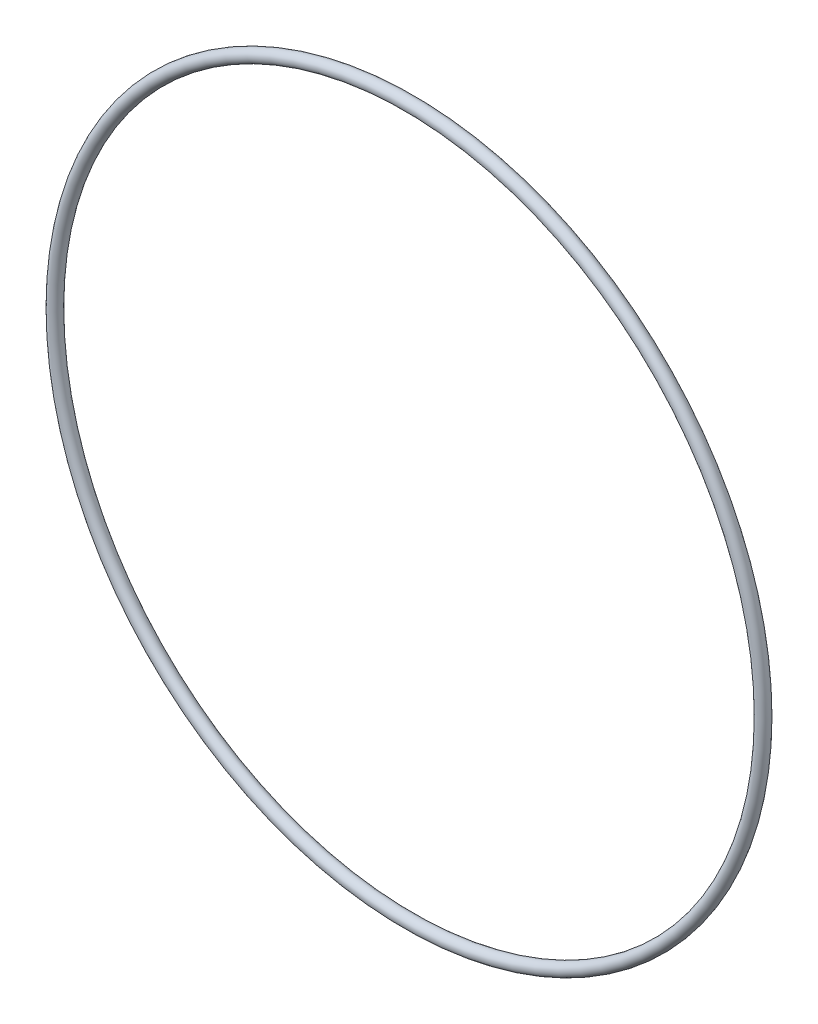
from build123d import *

# Parameters (mm, degrees)
SKETCH2_R = 0.89


with BuildPart() as part:
    # Sweep1: sweep along a path in Sketch1
    with BuildLine(Plane.XY) as sweep1_path:
        CenterArc((0, 0), 55, 0, 360)
    # Sketch2 → Sweep1 (sweep)
    with BuildSketch(Plane(origin=(0, 0, 0), x_dir=(1, 0, 0), z_dir=(0, 1, 0))):
        with Locations((-50.23, 0)):
            Circle(SKETCH2_R)
    sweep(path=sweep1_path.line)


solid = part.part
